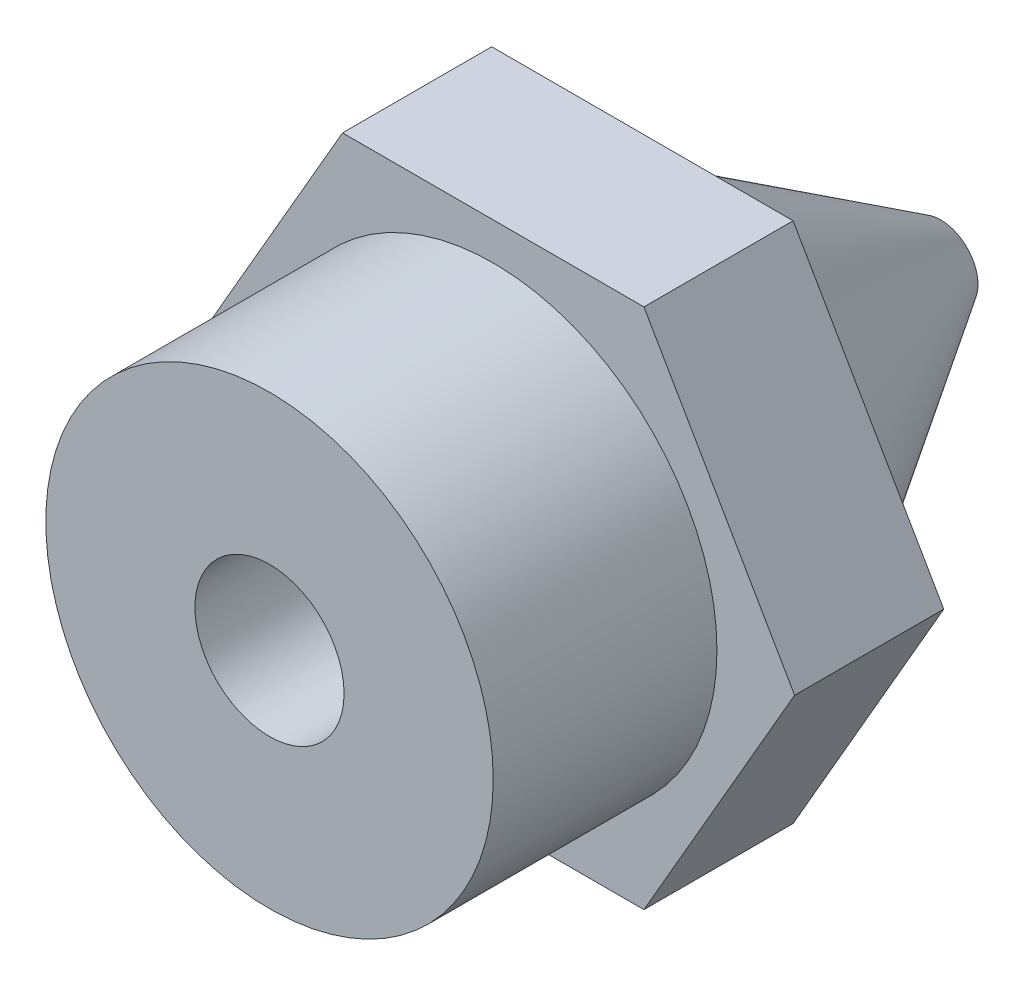
from build123d import *

# Parameters (mm, degrees)
BOSS_EXTRU_1_DEPTH                  = 9
ESQUISSE2_W                         = 15.557161579
ESQUISSE2_H                         = 11.468773674
ESQUISSE2_R                         = 3
ENL_V_MAT_EXTRU_1_DEPTH             = 3
DIAM_TRE_DU_PER_AGE_2_0_2_1_D       = 2
DIAM_TRE_DU_PER_AGE_2_0_2_1_DEPTH   = 7.5
DIAM_TRE_DU_PER_AGE_2_0_2_1_TIP     = 0.600860619
DIAM_TRE_DU_PER_AGE_1_5_1_5_1_D     = 1.5
DIAM_TRE_DU_PER_AGE_1_5_1_5_1_DEPTH = 8.2
DIAM_TRE_DU_PER_AGE_1_5_1_5_1_TIP   = 0.450645464
DIAM_TRE_DU_PER_AGE_0_4_0_4_1_D     = 0.4
DIAM_TRE_DU_PER_AGE_0_4_0_4_1_DEPTH = 0.7
DIAM_TRE_DU_PER_AGE_0_4_0_4_1_TIP   = 0.120172124
ENL_V_START                         = -4
ESQUISSE3_W                         = 15.323034965
ESQUISSE3_H                         = 11.861185192
ESQUISSE3_R                         = 3
ENL_V_MAT_EXTRU_3_DEPTH             = 4
CHANFREIN2_SIZE                     = 4
CHANFREIN2_SIZE_2                   = 2.499477408


with BuildPart() as part:
    # Esquisse1 → Boss.-Extru.1 (new body)
    with BuildSketch(Plane.XY):
        Polygon((4.041451884, 0), (2.020725942, 3.5), (-2.020725942, 3.5), (-4.041451884, 0), (-2.020725942, -3.5), (2.020725942, -3.5), align=None)
    extrude(amount=BOSS_EXTRU_1_DEPTH)

    # Esquisse2 → Enlèv. mat.-Extru.1 (cut)
    with BuildSketch(Plane.XY.offset(9)):
        with Locations((-0.212602531, -0.232116366)):
            Rectangle(ESQUISSE2_W, ESQUISSE2_H)
        Circle(ESQUISSE2_R, mode=Mode.SUBTRACT)
    extrude(amount=-ENL_V_MAT_EXTRU_1_DEPTH, mode=Mode.SUBTRACT)

    # Diamètre du perçage Ø2.0 (2)1
    with Locations(Plane.XY.offset(9)):
        with Locations((0, 0)):
            Hole(DIAM_TRE_DU_PER_AGE_2_0_2_1_D / 2, depth=DIAM_TRE_DU_PER_AGE_2_0_2_1_DEPTH)
            with Locations((0, 0, -(DIAM_TRE_DU_PER_AGE_2_0_2_1_DEPTH + DIAM_TRE_DU_PER_AGE_2_0_2_1_TIP / 2))):  # 118° drill point
                Cone(0, DIAM_TRE_DU_PER_AGE_2_0_2_1_D / 2, DIAM_TRE_DU_PER_AGE_2_0_2_1_TIP, mode=Mode.SUBTRACT)

    # Diamètre du perçage Ø1.5 (1.5)1
    with Locations(Plane.XY.offset(9)):
        with Locations((0, 0)):
            Hole(DIAM_TRE_DU_PER_AGE_1_5_1_5_1_D / 2, depth=DIAM_TRE_DU_PER_AGE_1_5_1_5_1_DEPTH)
            with Locations((0, 0, -(DIAM_TRE_DU_PER_AGE_1_5_1_5_1_DEPTH + DIAM_TRE_DU_PER_AGE_1_5_1_5_1_TIP / 2))):  # 118° drill point
                Cone(0, DIAM_TRE_DU_PER_AGE_1_5_1_5_1_D / 2, DIAM_TRE_DU_PER_AGE_1_5_1_5_1_TIP, mode=Mode.SUBTRACT)

    # Diamètre du perçage Ø0.4 (0.4)1
    with Locations(Plane(origin=(0, 0, 0), x_dir=(-1, 0, 0), z_dir=(0, 0, -1))):
        with Locations((0, 0)):
            Hole(DIAM_TRE_DU_PER_AGE_0_4_0_4_1_D / 2, depth=DIAM_TRE_DU_PER_AGE_0_4_0_4_1_DEPTH)
            with Locations((0, 0, -(DIAM_TRE_DU_PER_AGE_0_4_0_4_1_DEPTH + DIAM_TRE_DU_PER_AGE_0_4_0_4_1_TIP / 2))):  # 118° drill point
                Cone(0, DIAM_TRE_DU_PER_AGE_0_4_0_4_1_D / 2, DIAM_TRE_DU_PER_AGE_0_4_0_4_1_TIP, mode=Mode.SUBTRACT)

    # Esquisse3 → Enlèv. mat.-Extru.3 (cut)
    with BuildSketch(Plane(origin=(0, 0, 0), x_dir=(-1, 0, 0), z_dir=(0, 0, -1)).offset(ENL_V_START)):
        with Locations((0.20407301, -0.146192801)):
            Rectangle(ESQUISSE3_W, ESQUISSE3_H)
        with Locations(Location((0, 0, 0), (0, 0, 180))):
            Circle(ESQUISSE3_R, mode=Mode.SUBTRACT)
    extrude(amount=ENL_V_MAT_EXTRU_3_DEPTH, mode=Mode.SUBTRACT)

    # Chanfrein2
    # the kernel refuses this chamfer: 4, 2.499477408 mm, written as the material it takes off along each edge
    with BuildSketch(Plane(origin=(0, 0, 0), x_dir=(1, 0, 0), z_dir=(0, 1, 0))) as chanfrein2_piece_1_section:
        Polygon((3, -CHANFREIN2_SIZE), (3 - CHANFREIN2_SIZE_2, 0), (3, 0), align=None)
    chanfrein2_piece_1 = revolve(axis=Axis((0, 0, 0), (0, 0, -1)), mode=Mode.PRIVATE)
    chanfrein2_piece_1 = split(chanfrein2_piece_1, bisect_by=Plane(origin=(-1.744026904, 0, 4), z_dir=(0, 0, -1)), keep=Keep.TOP, mode=Mode.PRIVATE)
    add(chanfrein2_piece_1, mode=Mode.SUBTRACT)


solid = part.part
